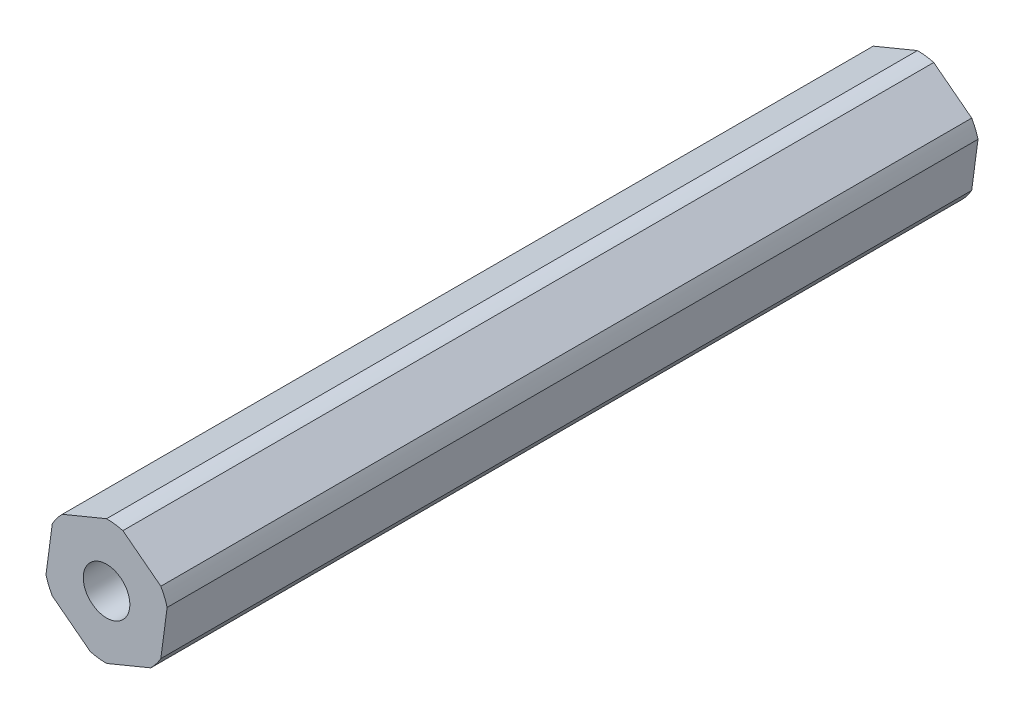
from build123d import *

# Parameters (mm, degrees)
BOSS_EXTRUDE1_DEPTH         = 88.9
F_1_4_20_TAPPED_HOLE1_D     = 5.1054
F_1_4_20_TAPPED_HOLE1_DEPTH = 16.51
F_1_4_20_TAPPED_HOLE1_TIP   = 1.533816902
F_1_4_20_TAPPED_HOLE2_D     = 5.1054
F_1_4_20_TAPPED_HOLE2_DEPTH = 16.51
F_1_4_20_TAPPED_HOLE2_TIP   = 1.533816902


with BuildPart() as part:
    # Sketch1 → Boss-Extrude1 (new body)
    with BuildSketch(Plane.XY):
        with BuildLine():
            Line((5.950200742, 3.43535), (1.789892893, 6.63346078))
            ThreePointArc((1.789892893, 6.63346078), (0.902773368, 6.811131972), (0, 6.8707))
            Line((0, 6.8707), (-4.849799104, 4.866823105))
            ThreePointArc((-4.849799104, 4.866823105), (-5.447226632, 4.187390656), (-5.950200742, 3.43535))
            Line((-5.950200742, 3.43535), (-6.639691997, -1.766637675))
            ThreePointArc((-6.639691997, -1.766637675), (-6.35, -2.623741315), (-5.950200742, -3.43535))
            Line((-5.950200742, -3.43535), (-1.789892893, -6.63346078))
            ThreePointArc((-1.789892893, -6.63346078), (-0.902773368, -6.811131972), (0, -6.8707))
            Line((0, -6.8707), (4.849799104, -4.866823105))
            ThreePointArc((4.849799104, -4.866823105), (5.447226632, -4.187390656), (5.950200742, -3.43535))
            Line((5.950200742, -3.43535), (6.639691997, 1.766637675))
            ThreePointArc((6.639691997, 1.766637675), (6.35, 2.623741315), (5.950200742, 3.43535))
        make_face()
    extrude(amount=BOSS_EXTRUDE1_DEPTH)

    # 1/4-20 Tapped Hole1
    with Locations(Plane.XY.offset(88.9)):
        with Locations((0, 0)):
            Hole(F_1_4_20_TAPPED_HOLE1_D / 2, depth=F_1_4_20_TAPPED_HOLE1_DEPTH)
            with Locations((0, 0, -(F_1_4_20_TAPPED_HOLE1_DEPTH + F_1_4_20_TAPPED_HOLE1_TIP / 2))):  # 118° drill point
                Cone(0, F_1_4_20_TAPPED_HOLE1_D / 2, F_1_4_20_TAPPED_HOLE1_TIP, mode=Mode.SUBTRACT)

    # 1/4-20 Tapped Hole2
    with Locations(Plane(origin=(0, 0, 0), x_dir=(-1, 0, 0), z_dir=(0, 0, -1))):
        with Locations((0, 0)):
            Hole(F_1_4_20_TAPPED_HOLE2_D / 2, depth=F_1_4_20_TAPPED_HOLE2_DEPTH)
            with Locations((0, 0, -(F_1_4_20_TAPPED_HOLE2_DEPTH + F_1_4_20_TAPPED_HOLE2_TIP / 2))):  # 118° drill point
                Cone(0, F_1_4_20_TAPPED_HOLE2_D / 2, F_1_4_20_TAPPED_HOLE2_TIP, mode=Mode.SUBTRACT)


solid = part.part
